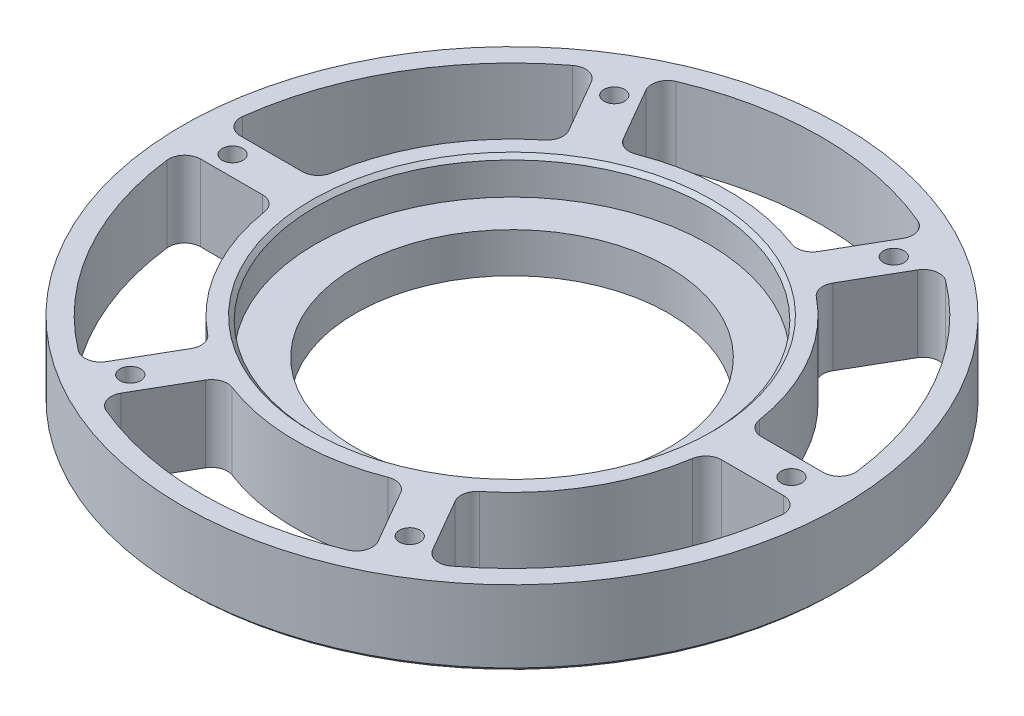
from build123d import *

# Parameters (mm, degrees)
F_6_0_204_DIAMETER_HOLE1_D = 5.1816
CIRPATTERN3_COUNT          = 6
CUT_EXTRUDE1_DEPTH         = 119.28739366475195
FILLET1_R                  = 4
CIRPATTERN4_COUNT          = 6
FILLET1_OF_CIRPATTERN4_R   = 4
CHAMFER1_SIZE              = 1
CHAMFER2_SIZE              = 1


with BuildPart() as part:
    # Sketch2 → Revolve1 (revolve)
    with BuildSketch(Plane(origin=(0, 0, 0), x_dir=(0, 0, -1), z_dir=(1, 0, 0))):
        Polygon((-39.2125, -8.7e-16), (-82.55, -5.31e-15), (-82.55, 19.049999999999994), (-49.2125, 19.049999999999994), (-49.21250000000001, 9.999999999999993), (-39.21250000000001, 9.999999999999991), align=None)
    revolve(axis=Axis((0, -0.9525000000000071, 0), (0, 1, 0)))

    # #6 (0.204) Diameter Hole1 (through all)
    with Locations(Plane(origin=(0, 19.049999999999994, 0), x_dir=(1, 0, 0), z_dir=(0, 1, 0))):
        with Locations((-35, 60.621778265)):
            f_6_0_204_diameter_hole1 = Hole(F_6_0_204_DIAMETER_HOLE1_D / 2)

    # CirPattern3: #6 (0.204) Diameter Hole1 ×6 about axis
    cirpattern3_axis = Axis((0, -0.9525000000000071, 0), (0, 1, 0))
    for i in range(1, CIRPATTERN3_COUNT):
        add(f_6_0_204_diameter_hole1.rotate(cirpattern3_axis, i * 360 / CIRPATTERN3_COUNT), mode=Mode.SUBTRACT)

    # Sketch8 → Cut-Extrude1 (cut, through all)
    with BuildSketch(Plane(origin=(0, 19.049999999999994, 0), x_dir=(1, 0, 0), z_dir=(0, 1, 0))):
        with BuildLine():
            Line((-34.36419588509058, 69.52053323422601), (-22.660589701137393, 49.249292691841845))
            ThreePointArc((-22.660589701137393, 49.249292691841845), (3.32e-15, 54.212500000000006), (22.660589701137393, 49.249292691841845))
            Line((22.660589701137393, 49.249292691841845), (34.36419588509058, 69.52053323422601))
            ThreePointArc((34.36419588509058, 69.52053323422601), (4.75e-15, 77.55), (-34.36419588509058, 69.52053323422601))
        make_face()
    cut_extrude1 = extrude(amount=-CUT_EXTRUDE1_DEPTH, mode=Mode.SUBTRACT)

    # Fillet1
    fillet1_edges = [part.edges().sort_by_distance(p)[0] for p in [
        (34.36419588509058, 9.524999999999997, -69.52053323422601),
        (22.660589701137397, 9.524999999999997, -49.249292691841845),
        (-34.36419588509059, 9.524999999999997, -69.52053323422601),
        (-22.660589701137393, 9.524999999999997, -49.249292691841845),
    ]]
    fillet(fillet1_edges, radius=FILLET1_R)

    # CirPattern4: Cut-Extrude1 ×6 about axis
    cirpattern4_axis = Axis((0, -0.9525000000000071, 0), (0, 1, 0))
    for i in range(1, CIRPATTERN4_COUNT):
        add(cut_extrude1.rotate(cirpattern4_axis, i * 360 / CIRPATTERN4_COUNT), mode=Mode.SUBTRACT)

    # Fillet1 of CirPattern4
    fillet1_of_cirpattern4_edges = [part.edges().sort_by_distance(p)[0] for p in [
        (-43.024449922934764, 9.524999999999997, -64.52053323422612),
        (-31.320843738981637, 9.524999999999997, -44.24929269184193),
        (-77.38864580802536, 9.524999999999997, -4.99999999999989),
        (-53.981433440119034, 9.524999999999997, -4.999999999999929),
        (-77.38864580802536, 9.524999999999997, 4.999999999999872),
        (-53.981433440119034, 9.524999999999997, 4.999999999999904),
        (-43.02444992293478, 9.524999999999997, 64.52053323422612),
        (-31.32084373898165, 9.524999999999997, 44.249292691841916),
        (-34.36419588509059, 9.524999999999997, 69.52053323422601),
        (-22.660589701137404, 9.524999999999997, 49.249292691841845),
        (34.36419588509058, 9.524999999999997, 69.52053323422601),
        (22.660589701137386, 9.524999999999997, 49.249292691841845),
        (43.02444992293474, 9.524999999999997, 64.52053323422614),
        (31.320843738981612, 9.524999999999997, 44.249292691841944),
        (77.38864580802536, 9.524999999999997, 4.999999999999922),
        (53.98143344011903, 9.524999999999997, 4.999999999999947),
        (77.38864580802536, 9.524999999999997, -4.999999999999897),
        (53.981433440119034, 9.524999999999997, -4.999999999999925),
        (43.024449922934764, 9.524999999999997, -64.52053323422614),
        (31.320843738981637, 9.524999999999997, -44.24929269184193),
    ]]
    fillet(fillet1_of_cirpattern4_edges, radius=FILLET1_OF_CIRPATTERN4_R)

    # Chamfer1
    chamfer1_edges = [part.edges().sort_by_distance(p)[0] for p in [
        (6.03e-15, 19.049999999999994, -49.2125),
    ]]
    chamfer(chamfer1_edges, length=CHAMFER1_SIZE)

    # Chamfer2
    chamfer2_edges = [part.edges().sort_by_distance(p)[0] for p in [
        (4.677e-14, -5.33e-15, -82.55),
    ]]
    chamfer(chamfer2_edges, length=CHAMFER2_SIZE)


solid = part.part
